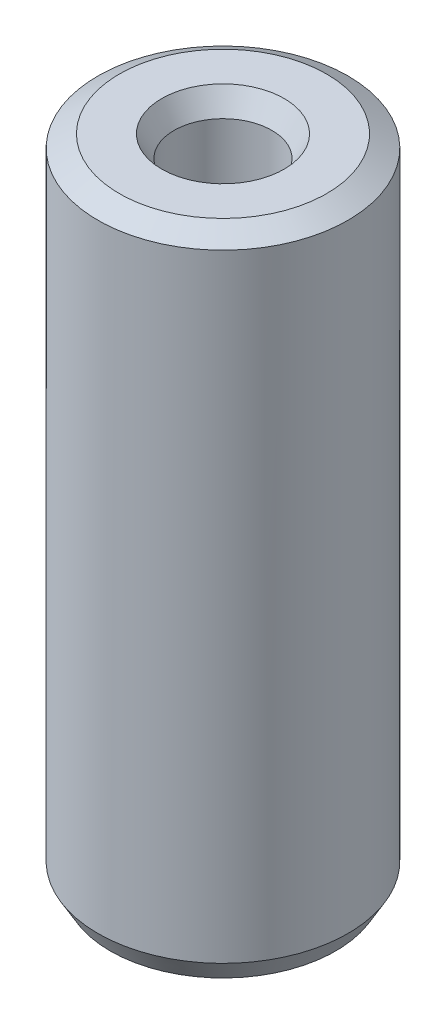
from build123d import *
from OCP.BRepFilletAPI import BRepFilletAPI_MakeChamfer

# Parameters (mm, degrees)
SKETCH1_R           = 32.5
BOSS_EXTRUDE1_DEPTH = 169.290342534
SKETCH2_R           = 12.69971228
CUT_EXTRUDE1_DEPTH  = 176.418699332
CHAMFER1_SIZE       = 3.2121282
CHAMFER1_SIZE2      = 5.563569243


with BuildPart() as part:
    # Sketch1 → Boss-Extrude1 (new body)
    with BuildSketch(Plane(origin=(0, 0, 0), x_dir=(1, 0, 0), z_dir=(0, 1, 0))):
        Circle(SKETCH1_R)
    extrude(amount=BOSS_EXTRUDE1_DEPTH)

    # Sketch2 → Cut-Extrude1 (cut, through all)
    with BuildSketch(Plane(origin=(0, 0, 0), x_dir=(1, 0, 0), z_dir=(0, 1, 0))):
        Circle(SKETCH2_R)
    extrude(amount=CUT_EXTRUDE1_DEPTH, mode=Mode.SUBTRACT)

    # Chamfer1: one chamfer whose edges measure the first distance from different faces: ONE call of the kernel's chamfer builder (chamfer() names one face for all edges)
    chamfer1_edges_1 = [part.edges().sort_by_distance(p)[0] for p in [
        (-12.69971228, 169.290342534, 0),
    ]]
    chamfer1_side_1 = [part.faces().sort_by_distance(p)[0] for p in [
        (-31.580761184, 169.290342534, 0),
    ]]
    chamfer1_edges_2 = [part.edges().sort_by_distance(p)[0] for p in [
        (-12.69971228, 0, 0),
    ]]
    chamfer1_side_2 = [part.faces().sort_by_distance(p)[0] for p in [
        (-12.69971228, 84.645171267, 0),
    ]]
    chamfer1_edges_3 = [part.edges().sort_by_distance(p)[0] for p in [
        (-32.5, 0, 0),
    ]]
    chamfer1_side_3 = [part.faces().sort_by_distance(p)[0] for p in [
        (-31.580761184, 0, 0),
    ]]
    chamfer1_edges_4 = [part.edges().sort_by_distance(p)[0] for p in [
        (-32.5, 169.290342534, 0),
    ]]
    chamfer1_side_4 = [part.faces().sort_by_distance(p)[0] for p in [
        (-32.5, 84.645171267, 0),
    ]]
    chamfer1 = BRepFilletAPI_MakeChamfer(part.part.solid().wrapped)
    for e in chamfer1_edges_1:
        chamfer1.Add(CHAMFER1_SIZE, CHAMFER1_SIZE2, e.wrapped, chamfer1_side_1[0].wrapped)  # the first distance lies on this face
    for e in chamfer1_edges_2:
        chamfer1.Add(CHAMFER1_SIZE, CHAMFER1_SIZE2, e.wrapped, chamfer1_side_2[0].wrapped)  # the first distance lies on this face
    for e in chamfer1_edges_3:
        chamfer1.Add(CHAMFER1_SIZE, CHAMFER1_SIZE2, e.wrapped, chamfer1_side_3[0].wrapped)  # the first distance lies on this face
    for e in chamfer1_edges_4:
        chamfer1.Add(CHAMFER1_SIZE, CHAMFER1_SIZE2, e.wrapped, chamfer1_side_4[0].wrapped)  # the first distance lies on this face
    add(Compound.cast(chamfer1.Shape()), mode=Mode.REPLACE)


solid = part.part
